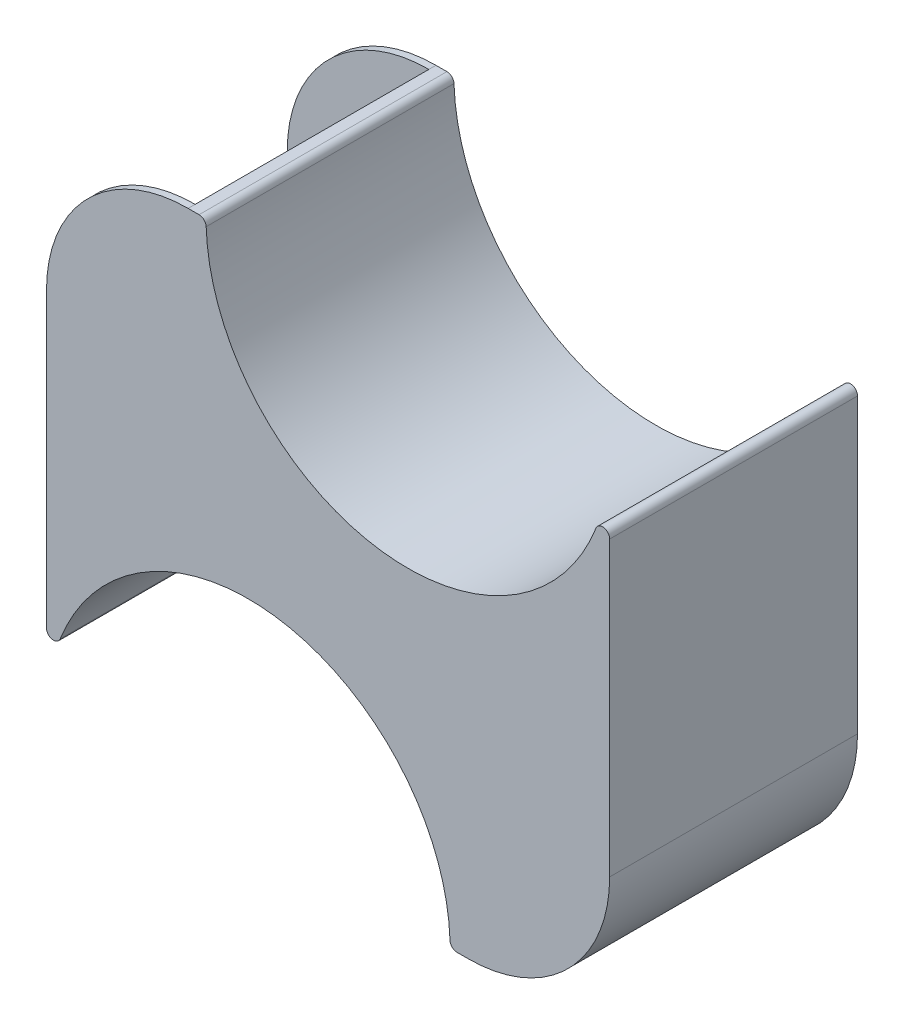
from build123d import *

# Parameters (mm, degrees)
EXTRUDE_1_DEPTH = 35
FILLET_1_R      = 1
FILLET_2_R      = 20
SHELL_START     = 1
SHELL_4_DEPTH   = 33


# Read off the part's stored shape, not the designer's step: 抽壳4
with BuildPart() as part:
    # 草图3 → 凸台-拉伸1 (new body)
    with BuildSketch(Plane.XY):
        with BuildLine():
            Line((-28.5, 0), (-51.03000000000027, -2.76e-15))
            Line((-51.03000000000027, -2.76e-15), (-51.029999999999994, -72))
            ThreePointArc((-51.029999999999994, -72), (-22.529999999999987, -43.5), (5.970000000000013, -72))
            Line((5.970000000000013, -72), (28.5, -72))
            Line((28.5, -72), (28.5, 0))
            ThreePointArc((28.5, 0), (-5.24e-15, -28.5), (-28.5, 0))
        make_face()
    extrude(amount=EXTRUDE_1_DEPTH)

    # 圆角1
    fillet_1_edges = [part.edges().sort_by_distance(p)[0] for p in [
        (5.970000000000011, -72, 17.5),
        (-51.02999999999999, -72, 17.5),
        (-28.5, -2.63e-15, 17.5),
    ]]
    fillet(fillet_1_edges, radius=FILLET_1_R)
    fillet_1_2_edges = [part.edges().sort_by_distance(p)[0] for p in [
        (28.5, 0, 17.5),
    ]]
    fillet(fillet_1_2_edges, radius=FILLET_1_R)

    # 圆角2
    fillet_2_edges = [part.edges().sort_by_distance(p)[0] for p in [
        (28.5, -72, 17.5),
        (-51.03000000000027, -2.76e-15, 17.5),
    ]]
    fillet(fillet_2_edges, radius=FILLET_2_R)

    # 抽壳4 outline → 抽壳4 (cut)
    with BuildSketch(Plane.XY.offset(SHELL_START)):
        with BuildLine():
            Line((-51.03, -20), (-50.03, -20))
            Line((-50.03, -20), (-50.03, -61.322921748))
            ThreePointArc((-50.03, -61.322921748), (-17.59091317, -42.916406321), (6.953045976, -71))
            Line((6.953045976, -71), (8.5, -71))
            ThreePointArc((8.5, -71), (21.935028843, -65.435028843), (27.5, -52))
            Line((27.5, -52), (27.5, -10.677078252))
            ThreePointArc((27.5, -10.677078252), (-4.93908683, -29.083593679), (-29.483045976, -1))
            Line((-29.483045976, -1), (-31.03, -1))
            Line((-31.03, -1), (-31.03, 0))
            ThreePointArc((-31.03, 0), (-45.172135624, -5.857864376), (-51.03, -20))
        make_face()
    extrude(amount=SHELL_4_DEPTH, mode=Mode.SUBTRACT)


solid = part.part
